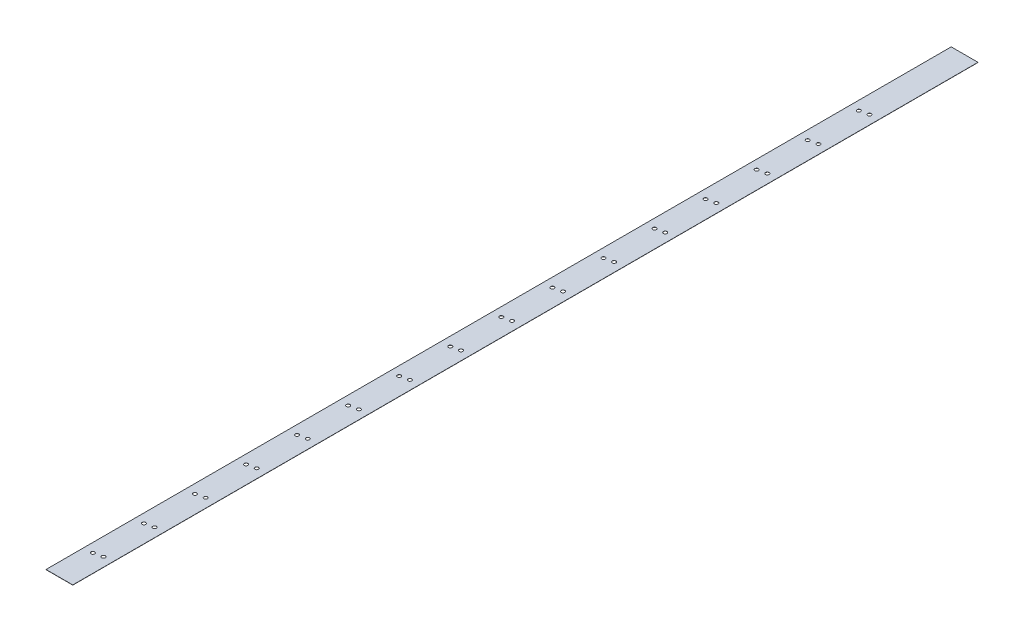
from build123d import *

# Parameters (mm, degrees)
SKETCH1_W           = 15
SKETCH1_H           = 507
BOSS_EXTRUDE1_DEPTH = 0.1
SKETCH2_R           = 1
CUT_EXTRUDE1_DEPTH  = 508.221854813


with BuildPart() as part:
    # Sketch1 → Boss-Extrude1 (new body)
    with BuildSketch(Plane(origin=(0, 0, 0), x_dir=(1, 0, 0), z_dir=(0, 1, 0))):
        with Locations((7.5, -253.5)):
            Rectangle(SKETCH1_W, SKETCH1_H)
    extrude(amount=BOSS_EXTRUDE1_DEPTH)

    # Sketch2 → Cut-Extrude1 (cut, through all)
    with BuildSketch(Plane(origin=(0, 0.1, 0), x_dir=(1, 0, 0), z_dir=(0, 1, 0))):
        with Locations((5.064074838, -485.830866202)):
            Circle(SKETCH2_R)
        with Locations((9.935925162, -484.706110931)):
            Circle(SKETCH2_R)
        with Locations((5.064074838, -457.230866202)):
            Circle(SKETCH2_R)
        with Locations((9.935925162, -456.106110931)):
            Circle(SKETCH2_R)
        with Locations((5.064074838, -428.630866202)):
            Circle(SKETCH2_R)
        with Locations((9.935925162, -427.506110931)):
            Circle(SKETCH2_R)
        with Locations((5.064074838, -400.030866202)):
            Circle(SKETCH2_R)
        with Locations((9.935925162, -398.906110931)):
            Circle(SKETCH2_R)
        with Locations((5.064074838, -371.430866202)):
            Circle(SKETCH2_R)
        with Locations((9.935925162, -370.306110931)):
            Circle(SKETCH2_R)
        with Locations((5.064074838, -342.830866202)):
            Circle(SKETCH2_R)
        with Locations((9.935925162, -341.706110931)):
            Circle(SKETCH2_R)
        with Locations((5.064074838, -314.230866202)):
            Circle(SKETCH2_R)
        with Locations((9.935925162, -313.106110931)):
            Circle(SKETCH2_R)
        with Locations((5.064074838, -285.630866202)):
            Circle(SKETCH2_R)
        with Locations((9.935925162, -284.506110931)):
            Circle(SKETCH2_R)
        with Locations((5.064074838, -257.030866202)):
            Circle(SKETCH2_R)
        with Locations((9.935925162, -255.906110931)):
            Circle(SKETCH2_R)
        with Locations((5.064074838, -228.430866202)):
            Circle(SKETCH2_R)
        with Locations((9.935925162, -227.306110931)):
            Circle(SKETCH2_R)
        with Locations((5.064074838, -199.830866202)):
            Circle(SKETCH2_R)
        with Locations((9.935925162, -198.706110931)):
            Circle(SKETCH2_R)
        with Locations((5.064074838, -171.230866202)):
            Circle(SKETCH2_R)
        with Locations((9.935925162, -170.106110931)):
            Circle(SKETCH2_R)
        with Locations((5.064074838, -142.630866202)):
            Circle(SKETCH2_R)
        with Locations((9.935925162, -141.506110931)):
            Circle(SKETCH2_R)
        with Locations((5.064074838, -114.030866202)):
            Circle(SKETCH2_R)
        with Locations((9.935925162, -112.906110931)):
            Circle(SKETCH2_R)
        with Locations((5.064074838, -85.430866202)):
            Circle(SKETCH2_R)
        with Locations((9.935925162, -84.306110931)):
            Circle(SKETCH2_R)
        with Locations((5.064074838, -56.830866202)):
            Circle(SKETCH2_R)
        with Locations((9.935925162, -55.706110931)):
            Circle(SKETCH2_R)
    extrude(amount=-CUT_EXTRUDE1_DEPTH, mode=Mode.SUBTRACT)


solid = part.part
